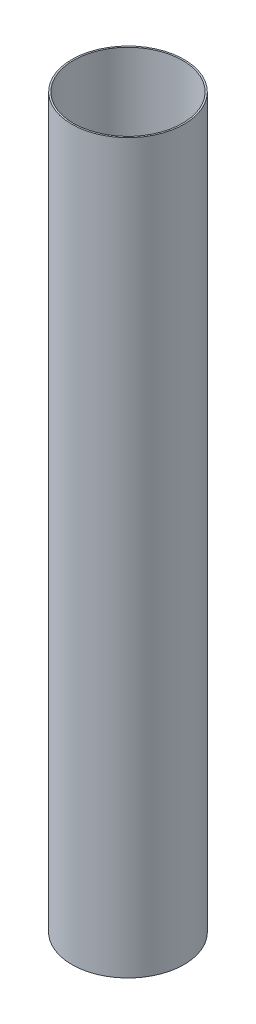
from build123d import *

# Parameters (mm, degrees)
BODY_TUBE_PROFILE_2_R   = 78.359
BODY_TUBE_PROFILE_2_R_2 = 76.2
BOSS_EXTRUDE1_DEPTH     = 1016


with BuildPart() as part:
    # Body Tube Profile<2> → Boss-Extrude1 (new body)
    with BuildSketch(Plane(origin=(0, 0, 0), x_dir=(1, 0, 0), z_dir=(0, 1, 0))):
        Circle(BODY_TUBE_PROFILE_2_R)
        Circle(BODY_TUBE_PROFILE_2_R_2, mode=Mode.SUBTRACT)
    extrude(amount=BOSS_EXTRUDE1_DEPTH)


solid = part.part
